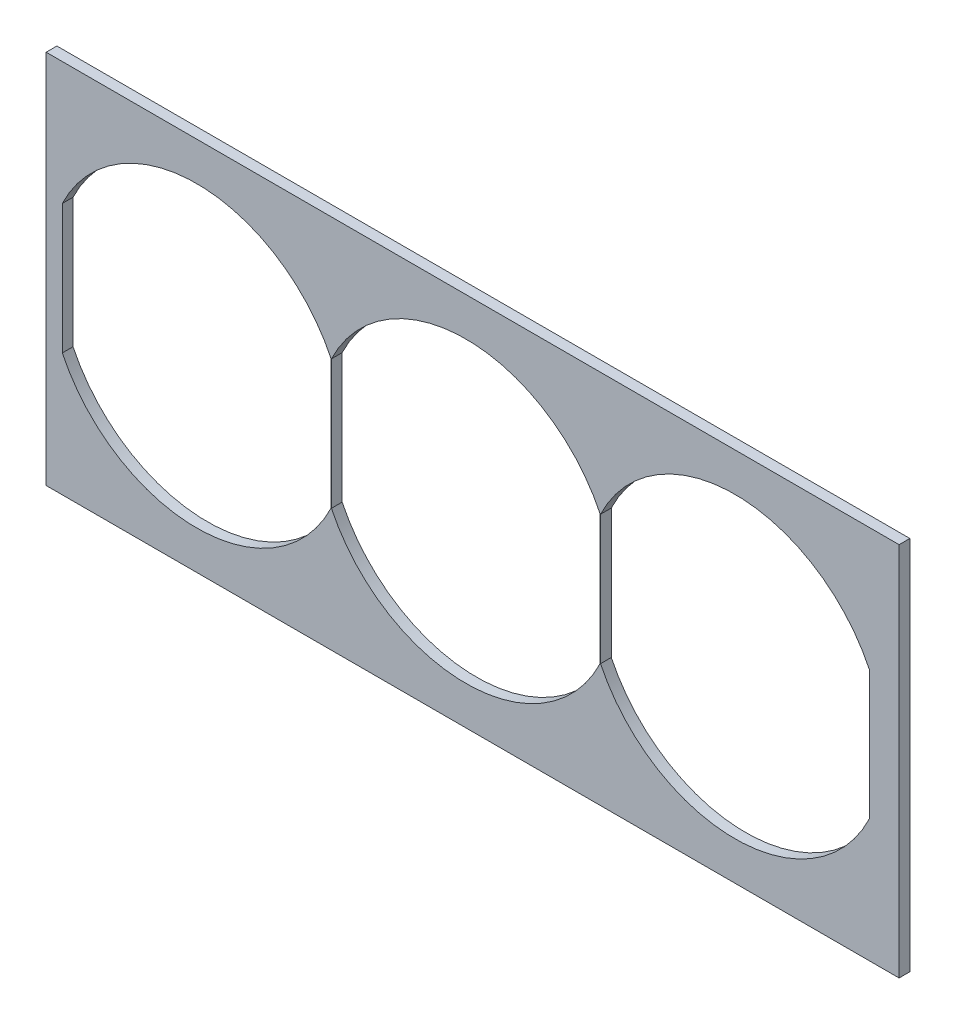
from build123d import *

# Parameters (mm, degrees)
SKETCH1_W           = 317.5
SKETCH1_H           = 139.7
BOSS_EXTRUDE1_DEPTH = 4
CUT_EXTRUDE1_DEPTH  = 10


with BuildPart() as part:
    # Sketch1 → Boss-Extrude1 (new body)
    with BuildSketch(Plane.XY):
        Rectangle(SKETCH1_W, SKETCH1_H)
    extrude(amount=BOSS_EXTRUDE1_DEPTH)

    # Sketch3 → Cut-Extrude1 (cut)
    with BuildSketch(Plane.XY.offset(4)):
        with BuildLine():
            Line((-52.5654, -24.09417772), (-52.5654, 24.09417772))
            ThreePointArc((-52.5654, 24.09417772), (-2.54, 55.5254), (47.4854, 24.09417772))
            Line((47.4854, 24.09417772), (47.4854, -24.09417772))
            ThreePointArc((47.4854, -24.09417772), (-2.54, -55.5254), (-52.5654, -24.09417772))
        make_face()
        with BuildLine():
            Line((47.6124, -24.09417772), (47.6124, 24.09417772))
            ThreePointArc((47.6124, 24.09417772), (97.6378, 55.5254), (147.6632, 24.09417772))
            Line((147.6632, 24.09417772), (147.6632, -24.09417772))
            ThreePointArc((147.6632, -24.09417772), (97.6378, -55.5254), (47.6124, -24.09417772))
        make_face()
        with BuildLine():
            Line((-152.7432, -24.09417772), (-152.7432, 24.09417772))
            ThreePointArc((-152.7432, 24.09417772), (-102.7178, 55.5254), (-52.6924, 24.09417772))
            Line((-52.6924, 24.09417772), (-52.6924, -24.09417772))
            ThreePointArc((-52.6924, -24.09417772), (-102.7178, -55.5254), (-152.7432, -24.09417772))
        make_face()
    extrude(amount=-CUT_EXTRUDE1_DEPTH, mode=Mode.SUBTRACT)


solid = part.part
